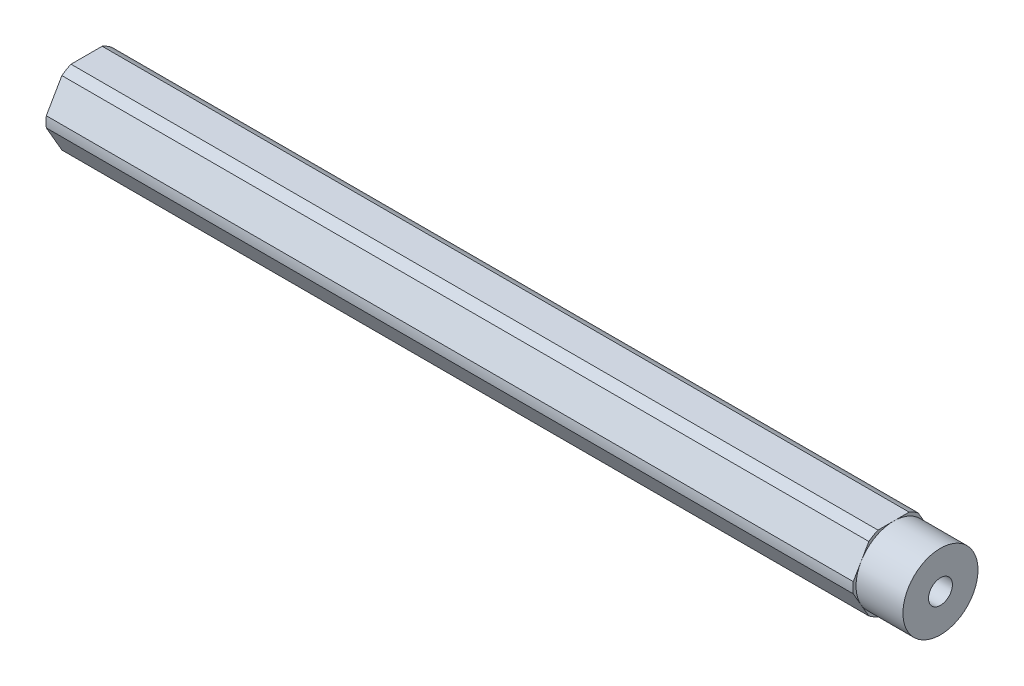
from build123d import *

# Parameters (mm, degrees)
SKETCH1_R                            = 2.0193
BOSS_EXTRUDE1_DEPTH                  = 72.23125
F_10_32_TAPPED_HOLE1_D               = 4.0386
F_10_32_TAPPED_HOLE1_DEPTH           = 16.34744
F_10_32_TAPPED_HOLE1_TIP             = 1.213317848
F_10_32_TAPPED_HOLE1_ON_FACE_2_D     = 4.0386
F_10_32_TAPPED_HOLE1_ON_FACE_2_DEPTH = 16.34744
F_10_32_TAPPED_HOLE1_ON_FACE_2_TIP   = 1.213317848
SKETCH3_R                            = 8.89
SKETCH3_R_2                          = 6.35
CUT_EXTRUDE_THIN1_DEPTH              = 7.9375


with BuildPart() as part:
    # Sketch1 → Boss-Extrude1 (new, symmetric)
    with BuildSketch(Plane(origin=(0, 0, 0), x_dir=(0, 0, -1), z_dir=(1, 0, 0))):
        with BuildLine():
            ThreePointArc((4.181770846, 5.456960429), (3.437499983, 5.953924622), (2.634980936, 6.35))
            Line((2.634980936, 6.35), (-2.634980936, 6.35))
            ThreePointArc((-2.634980936, 6.35), (-3.437499983, 5.953924622), (-4.181770846, 5.456960429))
            Line((-4.181770846, 5.456960429), (-6.816751782, 0.893039571))
            ThreePointArc((-6.816751782, 0.893039571), (-6.874999966, 0), (-6.816751782, -0.893039571))
            Line((-6.816751782, -0.893039571), (-4.181770846, -5.456960429))
            ThreePointArc((-4.181770846, -5.456960429), (-3.437499983, -5.953924622), (-2.634980936, -6.35))
            Line((-2.634980936, -6.35), (2.634980936, -6.35))
            ThreePointArc((2.634980936, -6.35), (3.437499983, -5.953924622), (4.181770846, -5.456960429))
            Line((4.181770846, -5.456960429), (6.816751782, -0.893039571))
            ThreePointArc((6.816751782, -0.893039571), (6.860422465, -0.447468582), (6.874999966, 0))
            ThreePointArc((6.874999966, 0), (6.860422465, 0.447468582), (6.816751782, 0.893039571))
            Line((6.816751782, 0.893039571), (4.181770846, 5.456960429))
        make_face()
        Circle(SKETCH1_R, mode=Mode.SUBTRACT)
    extrude(amount=BOSS_EXTRUDE1_DEPTH, both=True)

    # #10-32 Tapped Hole1
    with Locations(Plane(origin=(72.23125, 0, 0), x_dir=(0, 0, 1), z_dir=(1, 0, 0))):
        with Locations((0, 0)):
            Hole(F_10_32_TAPPED_HOLE1_D / 2, depth=F_10_32_TAPPED_HOLE1_DEPTH)
            with Locations((0, 0, -(F_10_32_TAPPED_HOLE1_DEPTH + F_10_32_TAPPED_HOLE1_TIP / 2))):  # 118° drill point
                Cone(0, F_10_32_TAPPED_HOLE1_D / 2, F_10_32_TAPPED_HOLE1_TIP, mode=Mode.SUBTRACT)

    # #10-32 Tapped Hole1 on face 2
    with Locations(Plane(origin=(-72.23125, 0, 0), x_dir=(0, 0, 1), z_dir=(1, 0, 0))):
        with Locations((0, 0)):
            Hole(F_10_32_TAPPED_HOLE1_ON_FACE_2_D / 2, depth=F_10_32_TAPPED_HOLE1_ON_FACE_2_DEPTH)
            with Locations((0, 0, -(F_10_32_TAPPED_HOLE1_ON_FACE_2_DEPTH + F_10_32_TAPPED_HOLE1_ON_FACE_2_TIP / 2))):  # 118° drill point
                Cone(0, F_10_32_TAPPED_HOLE1_ON_FACE_2_D / 2, F_10_32_TAPPED_HOLE1_ON_FACE_2_TIP, mode=Mode.SUBTRACT)

    # Sketch3 → Cut-Extrude-Thin1 (cut)
    with BuildSketch(Plane(origin=(72.23125, 0, 0), x_dir=(0, 0, -1), z_dir=(1, 0, 0))):
        Circle(SKETCH3_R)
        Circle(SKETCH3_R_2, mode=Mode.SUBTRACT)
    extrude(amount=-CUT_EXTRUDE_THIN1_DEPTH, mode=Mode.SUBTRACT)


solid = part.part
